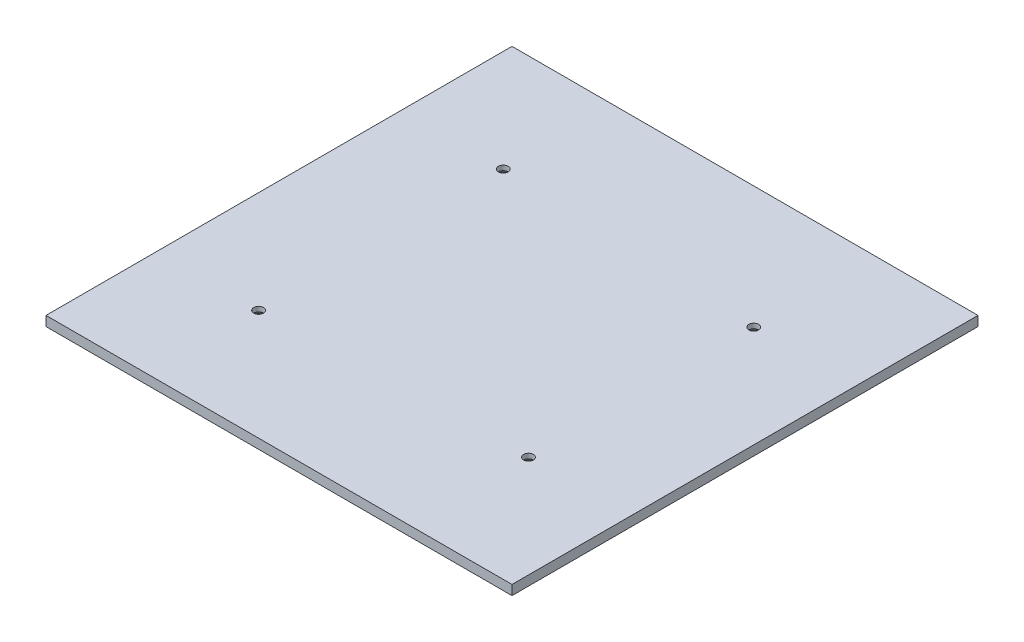
from build123d import *

# Parameters (mm, degrees)
SKETCH1_W           = 152.4
SKETCH1_H           = 152.4
BOSS_EXTRUDE1_DEPTH = 3.175
HOLE1_D             = 3.2
HOLE1_DEPTH         = 99.987199181
HOLE1_CSINK_D       = 6.4
HOLE1_CSINK_ANGLE   = 90


with BuildPart() as part:
    # Sketch1 → Boss-Extrude1 (new body)
    with BuildSketch(Plane(origin=(0, 0, 0), x_dir=(1, 0, 0), z_dir=(0, 1, 0))):
        with Locations((76.2, 76.2)):
            Rectangle(SKETCH1_W, SKETCH1_H)
    extrude(amount=BOSS_EXTRUDE1_DEPTH)

    # Hole1
    with Locations(Plane(origin=(0, 0, 0), x_dir=(-1, 0, 0), z_dir=(0, -1, 0))):
        with Locations((-119.0625, 38.735), (-33.3375, 36.195), (-33.3375, 116.205), (-119.0625, 112.395)):
            CounterSinkHole(HOLE1_D / 2, HOLE1_CSINK_D / 2, depth=HOLE1_DEPTH, counter_sink_angle=HOLE1_CSINK_ANGLE)


solid = part.part
